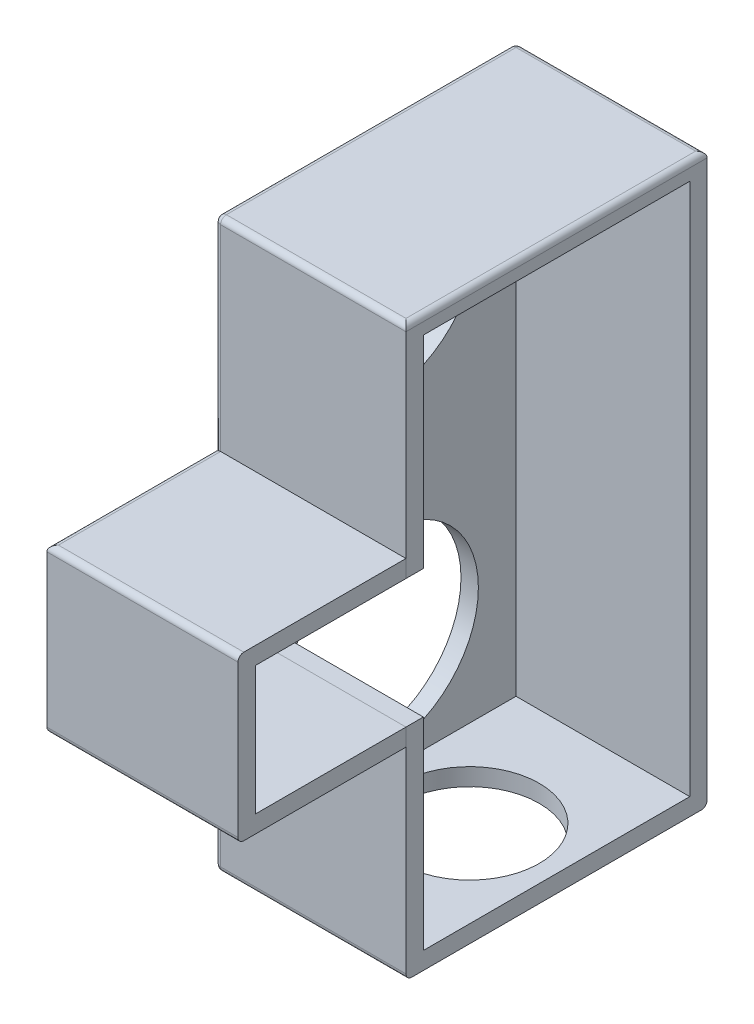
from build123d import *

# Parameters (mm, degrees)
SKETCH_1_W          = 15
SKETCH_1_H          = 23
EXTRUDE_1_DEPTH     = 46
SHELL_1_T           = 1.5
SKETCH_2_R          = 6
CUT_EXTRUDE_4_DEPTH = 1.5
SKETCH_3_R          = 8.25
CUT_EXTRUDE_5_DEPTH = 1.5
SKETCH_4_W          = 13.5
SKETCH_4_H          = 11.1
CUT_EXTRUDE_6_DEPTH = 10
EXTRUDE_2_DEPTH     = 13
SHELL_2_T           = 1.5
FILLET_3_R          = 0.5
SKETCH_7_W          = 1.5
SKETCH_7_H          = 11.1
CUT_EXTRUDE_7_DEPTH = 1.5
FILLET_4_R          = 0.5


with BuildPart() as part:
    # 草图1 → 凸台-拉伸1 (new body)
    with BuildSketch(Plane(origin=(0, 0, 0), x_dir=(1, 0, 0), z_dir=(0, 1, 0))):
        Rectangle(SKETCH_1_W, SKETCH_1_H)
    extrude(amount=EXTRUDE_1_DEPTH)

    # 抽壳1
    shell_1_openings = [part.faces().sort_by_distance(p)[0] for p in [
        (7.5, 23, 0),
    ]]
    offset(amount=SHELL_1_T, openings=shell_1_openings, kind=Kind.INTERSECTION)

    # 草图2 → 切除-拉伸4 (cut)
    with BuildSketch(Plane(origin=(0, 0, 0), x_dir=(-1, 0, 0), z_dir=(0, -1, 0))):
        with Locations(Location((0, 0, 0), (0, 0, 90))):
            Circle(SKETCH_2_R)
    extrude(amount=CUT_EXTRUDE_4_DEPTH, mode=Mode.SUBTRACT)

    # 草图3 → 切除-拉伸5 (cut)
    with BuildSketch(Plane.ZY.offset(9)):
        with Locations((0, 36.25)):
            Circle(SKETCH_3_R)
        with Locations(Location((0, 9.75, 0), (0, 0, 180))):
            Circle(SKETCH_3_R)
    extrude(amount=-CUT_EXTRUDE_5_DEPTH, mode=Mode.SUBTRACT)

    # 草图4 → 切除-拉伸6 (cut)
    with BuildSketch(Plane(origin=(0, 0, 11.5), x_dir=(-1, 0, 0), z_dir=(0, 0, -1))):
        with Locations((0.75, 23)):
            Rectangle(SKETCH_4_W, SKETCH_4_H)
    extrude(amount=-CUT_EXTRUDE_6_DEPTH, mode=Mode.SUBTRACT)

    # 圆角3
    fillet_3_edges = [part.edges().sort_by_distance(p)[0] for p in [
        (7.5, 47.5, 0),
        (-0.75, 47.5, -13),
        (-9, 47.5, 0),
        (-0.75, -1.5, -13),
        (-0.75, -1.5, 13),
        (-9, -1.5, 0),
        (-9, 23, -13),
        (-9, 23, 13),
        (-0.75, 47.5, 13),
    ]]
    fillet(fillet_3_edges, radius=FILLET_3_R)

    # 草图7 → 切除-拉伸7 (cut)
    with BuildSketch(Plane.XY.offset(13)):
        with Locations((6.75, 23)):
            Rectangle(SKETCH_7_W, SKETCH_7_H)
    extrude(amount=-CUT_EXTRUDE_7_DEPTH, mode=Mode.SUBTRACT)


with BuildPart() as body_2:
    # 草图5 → 凸台-拉伸2 (new body)
    with BuildSketch(Plane.XY.offset(13)):
        Polygon((-7.5, 28.55), (6, 28.55), (7.5, 28.55), (7.5, 17.45), (6, 17.45), (-7.5, 17.45), align=None)
    extrude(amount=EXTRUDE_2_DEPTH)

    # 抽壳2
    shell_2_openings = [body_2.faces().sort_by_distance(p)[0] for p in [
        (0, 23, 13),
        (7.5, 23, 19.5),
    ]]
    offset(amount=SHELL_2_T, openings=shell_2_openings, kind=Kind.INTERSECTION)

    # 圆角4
    # the kernel refuses this fillet: 0.5 mm, written as the material it takes off along each edge
    with BuildSketch(Plane(origin=(-9, 30.05, 11.75), x_dir=(1, 0, 0), z_dir=(0, 0, 1)), Plane(origin=(-9, 15.95, 28.75), x_dir=(1, 0, 0), z_dir=(0, 0, -1))) as fillet_4_piece_1:
        with BuildLine():
            CenterArc((FILLET_4_R, -FILLET_4_R), FILLET_4_R, 90, 90)
            Line((0, -FILLET_4_R), (0, 0))
            Line((0, 0), (FILLET_4_R, 0))
        make_face()
    extrude(amount=17, mode=Mode.SUBTRACT)
    with BuildSketch(Plane(origin=(8.75, 30.05, 27.5), x_dir=(0, 0, -1), z_dir=(-1, 0, 0)), Plane(origin=(-10.25, 15.95, 27.5), x_dir=(0, 0, -1), z_dir=(1, 0, 0))) as fillet_4_piece_2:
        with BuildLine():
            CenterArc((FILLET_4_R, FILLET_4_R), FILLET_4_R, 180, 90)
            Line((0, FILLET_4_R), (0, 0))
            Line((0, 0), (FILLET_4_R, 0))
        make_face()
    extrude(amount=19, mode=Mode.SUBTRACT)


solid = Compound([part.part, body_2.part])
